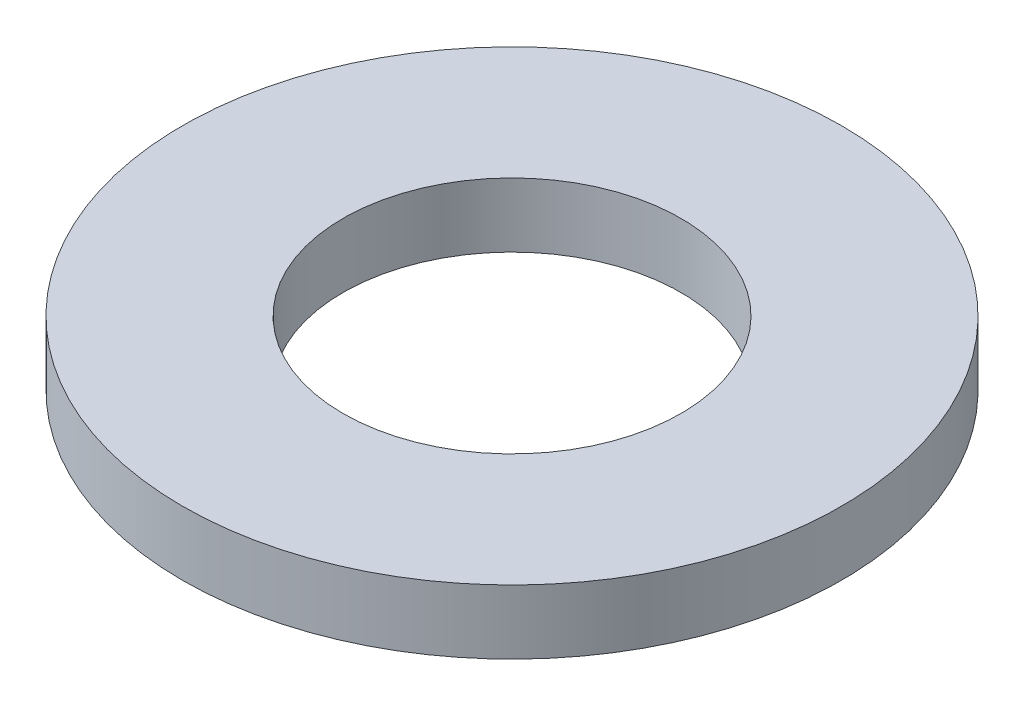
from build123d import *

# Parameters (mm, degrees)
SKETCH1_R           = 97.5
BOSS_EXTRUDE1_DEPTH = 19
SKETCH2_R           = 50
CUT_EXTRUDE1_DEPTH  = 140.188720807


with BuildPart() as part:
    # Sketch1 → Boss-Extrude1 (new body)
    with BuildSketch(Plane(origin=(0, 0, 0), x_dir=(1, 0, 0), z_dir=(0, 1, 0))):
        Circle(SKETCH1_R)
    extrude(amount=BOSS_EXTRUDE1_DEPTH)

    # Sketch2 → Cut-Extrude1 (cut, through all)
    with BuildSketch(Plane(origin=(0, 0, 0), x_dir=(1, 0, 0), z_dir=(0, 1, 0))):
        Circle(SKETCH2_R)
    extrude(amount=CUT_EXTRUDE1_DEPTH, mode=Mode.SUBTRACT)


solid = part.part
